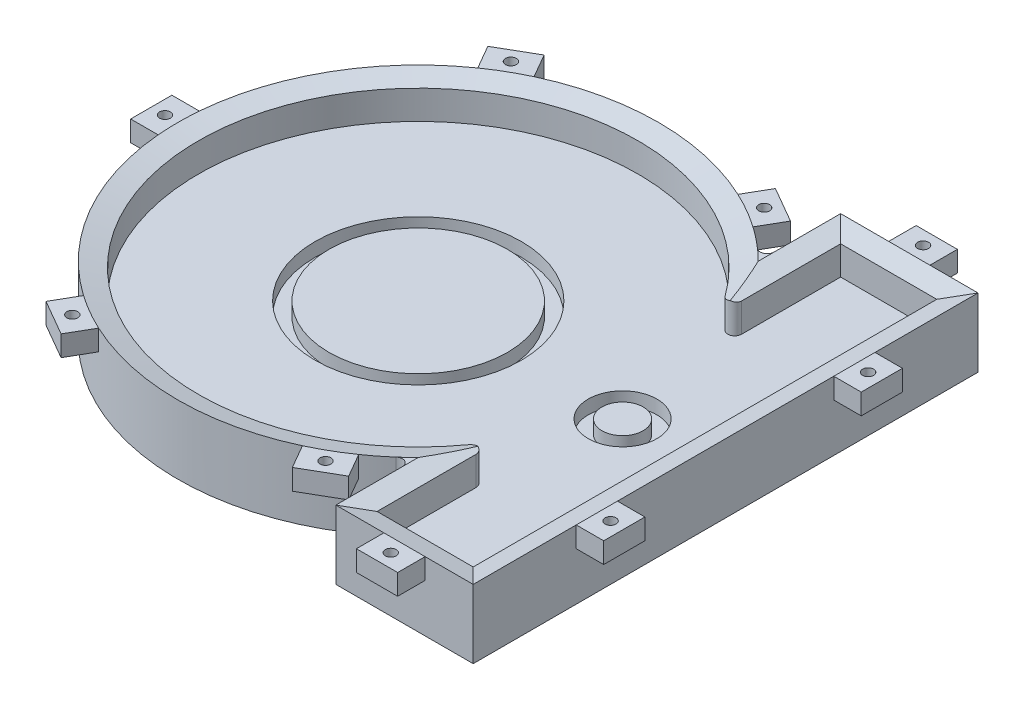
from build123d import *

# Parameters (mm, degrees)
SKETCH1_R           = 15
BOSS_EXTRUDE1_DEPTH = 5
BOSS_EXTRUDE2_DEPTH = 5
FILLET2_R           = 1
CHAMFER12_SIZE      = 3
CHAMFER12_SIZE_2    = 0.803847577
BOSS_EXTRUDE3_START = -3
SKETCH5_R           = 0.79375
SKETCH5_W           = 6
SKETCH5_H           = 4
SKETCH5_R_2         = 0.795
SKETCH5_W_2         = 4
SKETCH5_H_2         = 6
BOSS_EXTRUDE3_DEPTH = 3
FILLET3_R           = 1
BOSS_EXTRUDE4_START = -5
SKETCH6_R           = 15
BOSS_EXTRUDE4_DEPTH = 5
SKETCH7_R           = 15
SKETCH7_R_2         = 13
SKETCH7_R_3         = 5
SKETCH7_R_4         = 3
CUT_EXTRUDE1_DEPTH  = 2


with BuildPart() as part:
    # Sketch1 → Boss-Extrude1 (new body)
    with BuildSketch(Plane(origin=(0, 0, 0), x_dir=(1, 0, 0), z_dir=(0, 1, 0))):
        with BuildLine():
            Line((24.748737342, 24.748737342), (24.748737342, 36.748737342))
            Line((24.748737342, 36.748737342), (44.748737342, 36.748737342))
            Line((44.748737342, 36.748737342), (44.748737342, -36.748737342))
            Line((44.748737342, -36.748737342), (24.748737342, -36.748737342))
            Line((24.748737342, -36.748737342), (24.748737342, -24.748737342))
            ThreePointArc((24.748737342, -24.748737342), (-35, 0), (24.748737342, 24.748737342))
        make_face()
        with Locations(Location((0, 0, 0), (0, 0, 270))):
            Circle(SKETCH1_R, mode=Mode.SUBTRACT)
    extrude(amount=BOSS_EXTRUDE1_DEPTH)

    # Sketch2 → Boss-Extrude2 (add)
    with BuildSketch(Plane(origin=(0, 5, 0), x_dir=(1, 0, 0), z_dir=(0, 1, 0))):
        with BuildLine():
            Line((24.748737342, 24.748737342), (24.748737342, 36.748737342))
            Line((24.748737342, 36.748737342), (44.748737342, 36.748737342))
            Line((44.748737342, 36.748737342), (44.748737342, -36.748737342))
            Line((44.748737342, -36.748737342), (24.748737342, -36.748737342))
            Line((24.748737342, -36.748737342), (24.748737342, -24.748737342))
            ThreePointArc((24.748737342, -24.748737342), (-35, 0), (24.748737342, 24.748737342))
        make_face()
        with BuildLine():
            Line((27.748737342, -15.937615127), (27.748737342, -33.748737342))
            Line((27.748737342, -33.748737342), (41.748737342, -33.748737342))
            Line((41.748737342, -33.748737342), (41.748737342, 33.748737342))
            Line((41.748737342, 33.748737342), (27.748737342, 33.748737342))
            Line((27.748737342, 33.748737342), (27.748737342, 15.937615127))
            ThreePointArc((27.748737342, 15.937615127), (-32, 0), (27.748737342, -15.937615127))
        make_face(mode=Mode.SUBTRACT)
    extrude(amount=BOSS_EXTRUDE2_DEPTH)

    # Fillet2
    fillet2_edges = [part.edges().sort_by_distance(p)[0] for p in [
        (24.748737342, 5, -24.748737342),
        (24.748737342, 5, 24.748737342),
    ]]
    fillet(fillet2_edges, radius=FILLET2_R)

    # Chamfer12
    # the kernel refuses this chamfer: 3, 0.803847577 mm, written as the material it takes off along each edge
    with BuildSketch(Plane(origin=(0, 10, 0), x_dir=(0.9619307815124764, 0, -0.27329319709571387), z_dir=(0.27329319709571387, 0, 0.9619307815124764))) as chamfer12_piece_1:
        Polygon((32 + CHAMFER12_SIZE, 0), (32, -CHAMFER12_SIZE_2), (32, 0), align=None)
    revolve(axis=Axis((0, 10, 0), (0, 1, 0)), revolution_arc=328.279348711, mode=Mode.SUBTRACT)
    with BuildSketch(Plane(origin=(27.748737342, 10, 8.147450417), x_dir=(-1, 0, 0), z_dir=(0, 0, 1)), Plane(origin=(27.748737342, 10, -33.748737342), x_dir=(-1, 0, 0), z_dir=(0, 0, 1))) as chamfer12_piece_2:
        Polygon((CHAMFER12_SIZE, 0), (0, CHAMFER12_SIZE_2), (0, 0), align=None)
    extrude(amount=25.601286925, mode=Mode.SUBTRACT)
    with BuildSketch(Plane(origin=(27.748737342, 10, 33.748737342), x_dir=(0, 0, 1), z_dir=(1, 0, 0)), Plane(origin=(41.748737342, 10, -33.748737342), x_dir=(0, 0, -1), z_dir=(-1, 0, 0))) as chamfer12_piece_3:
        Polygon((CHAMFER12_SIZE, 0), (0, CHAMFER12_SIZE_2), (0, 0), align=None)
    extrude(amount=14, mode=Mode.SUBTRACT)
    with BuildSketch(Plane(origin=(41.748737342, 10, 33.748737342), x_dir=(1, 0, 0), z_dir=(0, 0, -1))) as chamfer12_piece_4:
        Polygon((CHAMFER12_SIZE, 0), (0, CHAMFER12_SIZE_2), (0, 0), align=None)
    extrude(amount=67.497474683, mode=Mode.SUBTRACT)
    with BuildSketch(Plane(origin=(27.748737342, 10, 8.147450417), x_dir=(-1, 0, 0), z_dir=(0, 0, 1))) as chamfer12_piece_5a_section:
        Polygon((CHAMFER12_SIZE, 0), (0, CHAMFER12_SIZE_2), (0, 0), align=None)
    chamfer12_piece_5a = extrude(amount=33.391451635, mode=Mode.PRIVATE)
    chamfer12_piece_5a = split(chamfer12_piece_5a, bisect_by=Plane(origin=(27.748737342, 10, 36.748737342), z_dir=(0, 0, -1)), keep=Keep.TOP, mode=Mode.PRIVATE)
    chamfer12_piece_5a = split(chamfer12_piece_5a, bisect_by=Plane(origin=(27.748737342, 10, 33.748737342), z_dir=(0, 0, 1)), keep=Keep.TOP, mode=Mode.PRIVATE)
    with BuildSketch(Plane(origin=(19.958572631, 10, 33.748737342), x_dir=(0, 0, 1), z_dir=(1, 0, 0))) as chamfer12_piece_5b_section:
        Polygon((CHAMFER12_SIZE, 0), (0, CHAMFER12_SIZE_2), (0, 0), align=None)
    chamfer12_piece_5b = extrude(amount=21.790164711, mode=Mode.PRIVATE)
    chamfer12_piece_5b = split(chamfer12_piece_5b, bisect_by=Plane(origin=(24.748737342, 10, 33.748737342), z_dir=(1, 0, 0)), keep=Keep.TOP, mode=Mode.PRIVATE)
    chamfer12_piece_5b = split(chamfer12_piece_5b, bisect_by=Plane(origin=(27.748737342, 10, 33.748737342), z_dir=(-1, 0, 0)), keep=Keep.TOP, mode=Mode.PRIVATE)
    chamfer12_piece_5 = chamfer12_piece_5a & chamfer12_piece_5b
    add(chamfer12_piece_5, mode=Mode.SUBTRACT)
    with BuildSketch(Plane(origin=(27.748737342, 10, 33.748737342), x_dir=(0, 0, 1), z_dir=(1, 0, 0))) as chamfer12_piece_6a_section:
        Polygon((CHAMFER12_SIZE, 0), (0, CHAMFER12_SIZE_2), (0, 0), align=None)
    chamfer12_piece_6a = extrude(amount=21.790164711, mode=Mode.PRIVATE)
    chamfer12_piece_6a = split(chamfer12_piece_6a, bisect_by=Plane(origin=(44.748737342, 10, 33.748737342), z_dir=(-1, 0, 0)), keep=Keep.TOP, mode=Mode.PRIVATE)
    chamfer12_piece_6a = split(chamfer12_piece_6a, bisect_by=Plane(origin=(41.748737342, 10, 33.748737342), z_dir=(1, 0, 0)), keep=Keep.TOP, mode=Mode.PRIVATE)
    with BuildSketch(Plane(origin=(41.748737342, 10, 41.538902052), x_dir=(1, 0, 0), z_dir=(0, 0, -1))) as chamfer12_piece_6b_section:
        Polygon((CHAMFER12_SIZE, 0), (0, CHAMFER12_SIZE_2), (0, 0), align=None)
    chamfer12_piece_6b = extrude(amount=75.287639394, mode=Mode.PRIVATE)
    chamfer12_piece_6b = split(chamfer12_piece_6b, bisect_by=Plane(origin=(41.748737342, 10, 36.748737342), z_dir=(0, 0, -1)), keep=Keep.TOP, mode=Mode.PRIVATE)
    chamfer12_piece_6b = split(chamfer12_piece_6b, bisect_by=Plane(origin=(41.748737342, 10, 33.748737342), z_dir=(0, 0, 1)), keep=Keep.TOP, mode=Mode.PRIVATE)
    chamfer12_piece_6 = chamfer12_piece_6a & chamfer12_piece_6b
    add(chamfer12_piece_6, mode=Mode.SUBTRACT)
    with BuildSketch(Plane(origin=(41.748737342, 10, 33.748737342), x_dir=(1, 0, 0), z_dir=(0, 0, -1))) as chamfer12_piece_7a_section:
        Polygon((CHAMFER12_SIZE, 0), (0, CHAMFER12_SIZE_2), (0, 0), align=None)
    chamfer12_piece_7a = extrude(amount=75.287639394, mode=Mode.PRIVATE)
    chamfer12_piece_7a = split(chamfer12_piece_7a, bisect_by=Plane(origin=(41.748737342, 10, -36.748737342), z_dir=(0, 0, 1)), keep=Keep.TOP, mode=Mode.PRIVATE)
    chamfer12_piece_7a = split(chamfer12_piece_7a, bisect_by=Plane(origin=(41.748737342, 10, -33.748737342), z_dir=(0, 0, -1)), keep=Keep.TOP, mode=Mode.PRIVATE)
    with BuildSketch(Plane(origin=(49.538902052, 10, -33.748737342), x_dir=(0, 0, -1), z_dir=(-1, 0, 0))) as chamfer12_piece_7b_section:
        Polygon((CHAMFER12_SIZE, 0), (0, CHAMFER12_SIZE_2), (0, 0), align=None)
    chamfer12_piece_7b = extrude(amount=21.790164711, mode=Mode.PRIVATE)
    chamfer12_piece_7b = split(chamfer12_piece_7b, bisect_by=Plane(origin=(44.748737342, 10, -33.748737342), z_dir=(-1, 0, 0)), keep=Keep.TOP, mode=Mode.PRIVATE)
    chamfer12_piece_7b = split(chamfer12_piece_7b, bisect_by=Plane(origin=(41.748737342, 10, -33.748737342), z_dir=(1, 0, 0)), keep=Keep.TOP, mode=Mode.PRIVATE)
    chamfer12_piece_7 = chamfer12_piece_7a & chamfer12_piece_7b
    add(chamfer12_piece_7, mode=Mode.SUBTRACT)
    with BuildSketch(Plane(origin=(41.748737342, 10, -33.748737342), x_dir=(0, 0, -1), z_dir=(-1, 0, 0))) as chamfer12_piece_8a_section:
        Polygon((CHAMFER12_SIZE, 0), (0, CHAMFER12_SIZE_2), (0, 0), align=None)
    chamfer12_piece_8a = extrude(amount=21.790164711, mode=Mode.PRIVATE)
    chamfer12_piece_8a = split(chamfer12_piece_8a, bisect_by=Plane(origin=(24.748737342, 10, -33.748737342), z_dir=(1, 0, 0)), keep=Keep.TOP, mode=Mode.PRIVATE)
    chamfer12_piece_8a = split(chamfer12_piece_8a, bisect_by=Plane(origin=(27.748737342, 10, -33.748737342), z_dir=(-1, 0, 0)), keep=Keep.TOP, mode=Mode.PRIVATE)
    with BuildSketch(Plane(origin=(27.748737342, 10, -41.538902052), x_dir=(-1, 0, 0), z_dir=(0, 0, 1))) as chamfer12_piece_8b_section:
        Polygon((CHAMFER12_SIZE, 0), (0, CHAMFER12_SIZE_2), (0, 0), align=None)
    chamfer12_piece_8b = extrude(amount=33.391451635, mode=Mode.PRIVATE)
    chamfer12_piece_8b = split(chamfer12_piece_8b, bisect_by=Plane(origin=(27.748737342, 10, -36.748737342), z_dir=(0, 0, 1)), keep=Keep.TOP, mode=Mode.PRIVATE)
    chamfer12_piece_8b = split(chamfer12_piece_8b, bisect_by=Plane(origin=(27.748737342, 10, -33.748737342), z_dir=(0, 0, -1)), keep=Keep.TOP, mode=Mode.PRIVATE)
    chamfer12_piece_8 = chamfer12_piece_8a & chamfer12_piece_8b
    add(chamfer12_piece_8, mode=Mode.SUBTRACT)

    # Sketch5 → Boss-Extrude3 (add)
    # profile 1 of 9: a face of its own
    with BuildSketch(Plane(origin=(0, 10, 0), x_dir=(1, 0, 0), z_dir=(0, 1, 0)).offset(BOSS_EXTRUDE3_START)):
        with BuildLine():
            Line((-34.871191548, 3), (-38.871191548, 3))
            Line((-38.871191548, 3), (-38.871191548, -3))
            Line((-38.871191548, -3), (-34.871191548, -3))
            ThreePointArc((-34.871191548, -3), (-35, 0), (-34.871191548, 3))
        make_face()
        with Locations(Location((-36.871191548, 0, 0), (0, 0, 270))):
            Circle(SKETCH5_R, mode=Mode.SUBTRACT)
    # profile 2 of 9: a face of its own
    with BuildSketch(Plane(origin=(0, 10, 0), x_dir=(1, 0, 0), z_dir=(0, 1, 0)).offset(BOSS_EXTRUDE3_START)):
        with BuildLine():
            Line((-14.837519563, 31.699337741), (-16.837519563, 35.163439356))
            Line((-16.837519563, 35.163439356), (-22.033671986, 32.163439356))
            Line((-22.033671986, 32.163439356), (-20.033671986, 28.699337741))
            ThreePointArc((-20.033671986, 28.699337741), (-17.5, 30.310889132), (-14.837519563, 31.699337741))
        make_face()
        with Locations(Location((-18.435595774, 31.931388549, 0), (0, 0, 270))):
            Circle(SKETCH5_R, mode=Mode.SUBTRACT)
    # profile 3 of 9: a face of its own
    with BuildSketch(Plane(origin=(0, 10, 0), x_dir=(1, 0, 0), z_dir=(0, 1, 0)).offset(BOSS_EXTRUDE3_START)):
        with BuildLine():
            Line((20.033671986, 28.699337741), (22.033671986, 32.163439356))
            Line((22.033671986, 32.163439356), (16.837519563, 35.163439356))
            Line((16.837519563, 35.163439356), (14.837519563, 31.699337741))
            ThreePointArc((14.837519563, 31.699337741), (17.5, 30.310889132), (20.033671986, 28.699337741))
        make_face()
        with Locations(Location((18.435595774, 31.931388549, 0), (0, 0, 270))):
            Circle(SKETCH5_R, mode=Mode.SUBTRACT)
    # profile 4 of 9: a face of its own
    with BuildSketch(Plane(origin=(0, 10, 0), x_dir=(1, 0, 0), z_dir=(0, 1, 0)).offset(BOSS_EXTRUDE3_START)):
        with BuildLine():
            Line((14.837519563, -31.699337741), (16.837519563, -35.163439356))
            Line((16.837519563, -35.163439356), (22.033671986, -32.163439356))
            Line((22.033671986, -32.163439356), (20.033671986, -28.699337741))
            ThreePointArc((20.033671986, -28.699337741), (17.5, -30.310889132), (14.837519563, -31.699337741))
        make_face()
        with Locations(Location((18.435595774, -31.931388549, 0), (0, 0, 270))):
            Circle(SKETCH5_R, mode=Mode.SUBTRACT)
    # profile 5 of 9: a face of its own
    with BuildSketch(Plane(origin=(0, 10, 0), x_dir=(1, 0, 0), z_dir=(0, 1, 0)).offset(BOSS_EXTRUDE3_START)):
        with BuildLine():
            Line((-20.033671986, -28.699337741), (-22.033671986, -32.163439356))
            Line((-22.033671986, -32.163439356), (-16.837519563, -35.163439356))
            Line((-16.837519563, -35.163439356), (-14.837519563, -31.699337741))
            ThreePointArc((-14.837519563, -31.699337741), (-17.5, -30.310889132), (-20.033671986, -28.699337741))
        make_face()
        with Locations(Location((-18.435595774, -31.931388549, 0), (0, 0, 270))):
            Circle(SKETCH5_R, mode=Mode.SUBTRACT)
    # profile 6 of 9: a face of its own
    with BuildSketch(Plane(origin=(0, 10, 0), x_dir=(1, 0, 0), z_dir=(0, 1, 0)).offset(BOSS_EXTRUDE3_START)):
        with Locations((34.748737342, 38.748737342)):
            Rectangle(SKETCH5_W, SKETCH5_H)
        with Locations(Location((34.748737342, 38.748737342, 0), (0, 0, 270))):
            Circle(SKETCH5_R_2, mode=Mode.SUBTRACT)
    # profile 7 of 9: a face of its own
    with BuildSketch(Plane(origin=(0, 10, 0), x_dir=(1, 0, 0), z_dir=(0, 1, 0)).offset(BOSS_EXTRUDE3_START)):
        with Locations((46.748737342, 18.748737342)):
            Rectangle(SKETCH5_W_2, SKETCH5_H_2)
        with Locations(Location((46.748737342, 18.748737342, 0), (0, 0, 270))):
            Circle(SKETCH5_R_2, mode=Mode.SUBTRACT)
    # profile 8 of 9: a face of its own
    with BuildSketch(Plane(origin=(0, 10, 0), x_dir=(1, 0, 0), z_dir=(0, 1, 0)).offset(BOSS_EXTRUDE3_START)):
        with Locations((46.748737342, -18.748737342)):
            Rectangle(SKETCH5_W_2, SKETCH5_H_2)
        with Locations(Location((46.748737342, -18.748737342, 0), (0, 0, 90))):
            Circle(SKETCH5_R_2, mode=Mode.SUBTRACT)
    # profile 9 of 9: a face of its own
    with BuildSketch(Plane(origin=(0, 10, 0), x_dir=(1, 0, 0), z_dir=(0, 1, 0)).offset(BOSS_EXTRUDE3_START)):
        with Locations((34.748737342, -38.748737342)):
            Rectangle(SKETCH5_W, SKETCH5_H)
        with Locations(Location((34.748737342, -38.748737342, 0), (0, 0, 90))):
            Circle(SKETCH5_R_2, mode=Mode.SUBTRACT)
    extrude(amount=BOSS_EXTRUDE3_DEPTH)

    # Fillet3
    fillet3_edges = [part.edges().sort_by_distance(p)[0] for p in [
        (27.748737342, 7.098076212, 15.937615127),
        (27.748737342, 7.098076212, -15.937615127),
    ]]
    fillet(fillet3_edges, radius=FILLET3_R)

    # Sketch6 → Boss-Extrude4 (add)
    with BuildSketch(Plane(origin=(0, 5, 0), x_dir=(1, 0, 0), z_dir=(0, 1, 0)).offset(BOSS_EXTRUDE4_START)):
        Circle(SKETCH6_R)
    extrude(amount=BOSS_EXTRUDE4_DEPTH)

    # Sketch7 → Cut-Extrude1 (cut)
    # profile 1 of 2: a face of its own
    with BuildSketch(Plane(origin=(0, 5, 0), x_dir=(1, 0, 0), z_dir=(0, 1, 0))):
        with Locations(Location((0, 0, 0), (0, 0, 270))):
            Circle(SKETCH7_R)
        with Locations(Location((0, 0, 0), (0, 0, 270))):
            Circle(SKETCH7_R_2, mode=Mode.SUBTRACT)
    # profile 2 of 2: a face of its own
    with BuildSketch(Plane(origin=(0, 5, 0), x_dir=(1, 0, 0), z_dir=(0, 1, 0))):
        with Locations(Location((29.748737342, 0, 0), (0, 0, 270))):
            Circle(SKETCH7_R_3)
        with Locations(Location((29.748737342, 0, 0), (0, 0, 270))):
            Circle(SKETCH7_R_4, mode=Mode.SUBTRACT)
    extrude(amount=-CUT_EXTRUDE1_DEPTH, mode=Mode.SUBTRACT)


solid = part.part
